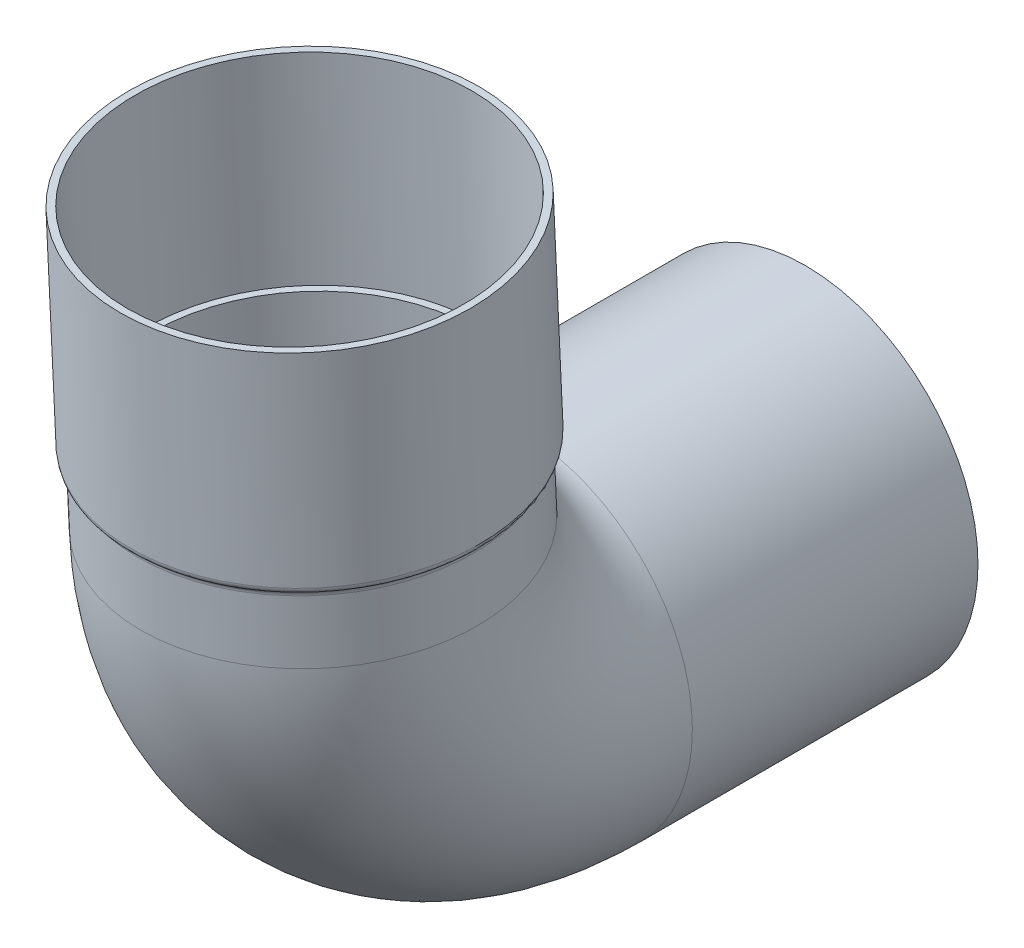
from build123d import *

# Parameters (mm, degrees)
ESQUISSE6_R        = 25
ESQUISSE6_R_2      = 24
ESQUISSE8_R        = 26.000000000000007
ESQUISSE8_R_2      = 24.000000000000007
EXTRU_MINCE1_DEPTH = 1
EXTRU_MINCE2_START = 30
ESQUISSE9_R        = 26
ESQUISSE9_R_2      = 25
EXTRU_MINCE2_DEPTH = 30
CONG_1_R           = 1
CONG_2_R           = 1


with BuildPart() as part:
    # Balayage-Mince2: sweep along a path in Esquisse7
    with BuildLine(Plane(origin=(0, 0, 0), x_dir=(0, 0, -1), z_dir=(1, 0, 0))) as balayage_mince2_path:
        Line((0, 0), (-41.38142332276701, -3.47e-15))
        ThreePointArc((-41.38142332276701, -3.47e-15), (-62.08896052980016, 8.292906624346546), (-71.34811957162613, 28.58680647871081))
        Line((-71.34811957162613, 28.58680647871081), (-71.83715157767594, 38.95670512351683))
    # Esquisse6 → Balayage-Mince2 (sweep)
    with BuildSketch(Plane.XY):
        Circle(ESQUISSE6_R)
        Circle(ESQUISSE6_R_2, mode=Mode.SUBTRACT)
    sweep(path=balayage_mince2_path.line)



with BuildPart() as body_2:
    # Esquisse8 → Extru.-Mince1 (new body)
    with BuildSketch(Plane(origin=(0, 42.25049608966464, 1.9924828165681323), x_dir=(1, 0, 0), z_dir=(0, 0.9988898749619701, 0.047106450709639855))):
        with Locations((0, -69.92229124733788)):
            Circle(ESQUISSE8_R)
        with Locations((0, -69.92229124733788)):
            Circle(ESQUISSE8_R_2, mode=Mode.SUBTRACT)
    extrude(amount=EXTRU_MINCE1_DEPTH)


with BuildPart() as part_1:
    add(part.part)

    add(body_2.part)  # Extru.-Mince2 merges body 2
    # Esquisse9 → Extru.-Mince2 (add)
    with BuildSketch(Plane(origin=(0, 43.249385964626626, 2.039589267277776), x_dir=(1, 0, 0), z_dir=(0, 0.9988898749619701, 0.04710645070963987)).offset(EXTRU_MINCE2_START)):
        with Locations((0, -69.92229124733788)):
            Circle(ESQUISSE9_R)
        with Locations((0, -69.92229124733788)):
            Circle(ESQUISSE9_R_2, mode=Mode.SUBTRACT)
    extrude(amount=-EXTRU_MINCE2_DEPTH)

    # Congé1
    cong_1_edges = [part_1.edges().sort_by_distance(p)[0] for p in [
        (-25, 38.95670512351683, 71.8371515776759),
    ]]
    fillet(cong_1_edges, radius=CONG_1_R - 0.0001)  # a hair under: the kernel refuses the full size

    # Congé2
    cong_2_edges = [part_1.edges().sort_by_distance(p)[0] for p in [
        (-26.000000000000007, 38.956705123516834, 71.83715157767593),
    ]]
    fillet(cong_2_edges, radius=CONG_2_R)


solid = part_1.part
